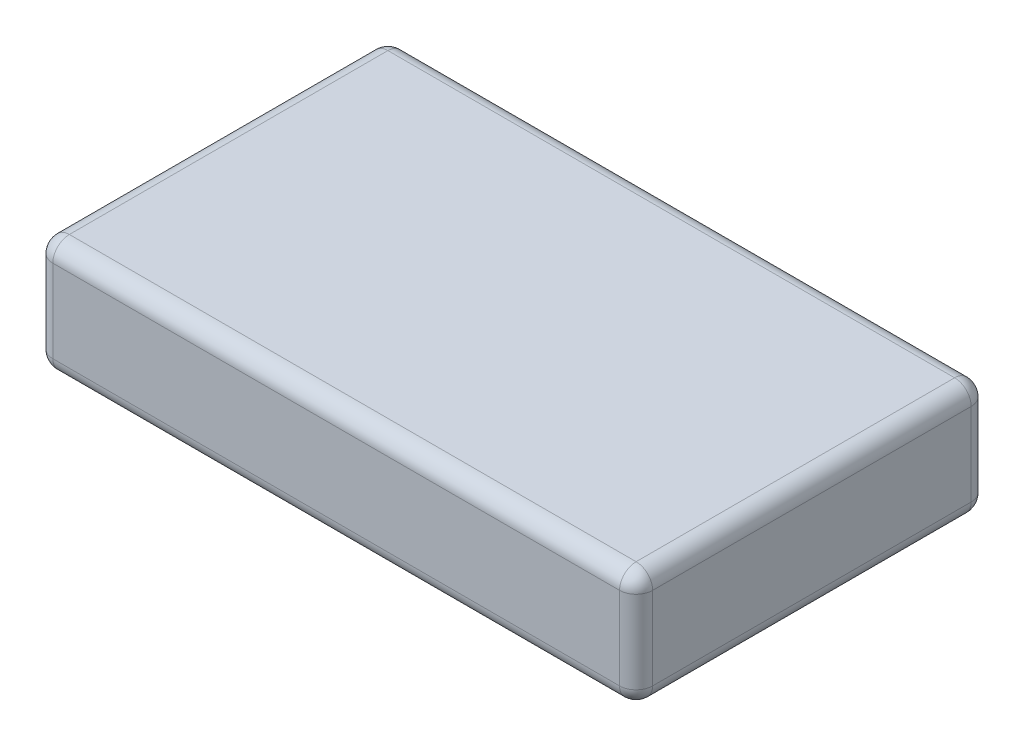
from build123d import *

# Parameters (mm, degrees)
IZIM1_W                     = 145
IZIM1_H                     = 85
Y_KSEKLIK_EKSTR_ZYON1_DEPTH = 28
IZIM2_R                     = 2.75
IZIM2_R_2                   = 0.5
KES_EKSTR_ZYON1_DEPTH       = 9
IZIM3_W                     = 4.5
IZIM3_H                     = 12
IZIM3_W_2                   = 2
IZIM3_H_2                   = 9.835751208
IZIM3_W_3                   = 0.86567422
IZIM3_H_3                   = 7
KES_EKSTR_ZYON2_DEPTH       = 9
RADYUS3_R                   = 4
RADYUS6_R                   = 4
RADYUS7_R                   = 4


with BuildPart() as part:
    # Çizim1 → Yükseklik-Ekstrüzyon1 (new body)
    with BuildSketch(Plane(origin=(0, 0, 0), x_dir=(1, 0, 0), z_dir=(0, 1, 0))):
        Rectangle(IZIM1_W, IZIM1_H)
    extrude(amount=Y_KSEKLIK_EKSTR_ZYON1_DEPTH)

    # Çizim2 → Kes-Ekstrüzyon1 (cut)
    with BuildSketch(Plane.ZY.offset(72.5)):
        with Locations((25.2, 12.4)):
            Circle(IZIM2_R)
        with Locations((25.2, 12.4)):
            Circle(IZIM2_R_2, mode=Mode.SUBTRACT)
    extrude(amount=-KES_EKSTR_ZYON1_DEPTH, mode=Mode.SUBTRACT)

    # Çizim3 → Kes-Ekstrüzyon2 (cut)
    with BuildSketch(Plane.ZY.offset(72.5)):
        with Locations((-26.625, 12.91875)):
            Rectangle(IZIM3_W, IZIM3_H)
        with Locations((-25.780796649, 12.91875)):
            Rectangle(IZIM3_W_2, IZIM3_H_2, mode=Mode.SUBTRACT)
        with Locations((-27.613610368, 12.91875)):
            Rectangle(IZIM3_W_3, IZIM3_H_3, mode=Mode.SUBTRACT)
    extrude(amount=-KES_EKSTR_ZYON2_DEPTH, mode=Mode.SUBTRACT)

    # Radyus3
    radyus3_edges = [part.edges().sort_by_distance(p)[0] for p in [
        (-72.5, 28, 0),
        (0, 28, 42.5),
        (72.5, 28, 0),
        (0, 28, -42.5),
    ]]
    fillet(radyus3_edges, radius=RADYUS3_R)

    # Radyus6
    radyus6_edges = [part.edges().sort_by_distance(p)[0] for p in [
        (0, 0, 42.5),
        (-72.5, 0, 0),
        (0, 0, -42.5),
        (72.5, 0, 0),
    ]]
    fillet(radyus6_edges, radius=RADYUS6_R)

    # Radyus7
    # the kernel refuses this fillet: 4 mm, written as the material it takes off along each edge
    with BuildSketch(Plane(origin=(-68.5, 24, 38.5), x_dir=(-1, 0, 0), z_dir=(0, 0, 1))) as radyus7_piece_1_section:
        Polygon((0, 0), (RADYUS7_R, 0), (RADYUS7_R, -RADYUS7_R), (0, -RADYUS7_R), align=None)
    radyus7_piece_1 = extrude(amount=RADYUS7_R, mode=Mode.PRIVATE)
    radyus7_piece_1 = radyus7_piece_1 - Plane(origin=(-68.5, 24, 38.5), x_dir=(0.7071067811865475, -0.7071067811865475, 0), z_dir=(0, 0, 1)) * Sphere(RADYUS7_R, mode=Mode.PRIVATE)
    add(radyus7_piece_1, mode=Mode.SUBTRACT)
    with BuildSketch(Plane(origin=(-68.5, 24, -38.5), x_dir=(0, 0, -1), z_dir=(-1, 0, 0))) as radyus7_piece_2_section:
        Polygon((0, 0), (RADYUS7_R, 0), (RADYUS7_R, -RADYUS7_R), (0, -RADYUS7_R), align=None)
    radyus7_piece_2 = extrude(amount=RADYUS7_R, mode=Mode.PRIVATE)
    radyus7_piece_2 = radyus7_piece_2 - Plane(origin=(-68.5, 24, -38.5), x_dir=(0, -0.7071067811865475, 0.7071067811865475), z_dir=(-1, 0, 0)) * Sphere(RADYUS7_R, mode=Mode.PRIVATE)
    add(radyus7_piece_2, mode=Mode.SUBTRACT)
    with BuildSketch(Plane(origin=(68.5, 24, 38.5), x_dir=(1, 0, 0), z_dir=(0, 0, 1))) as radyus7_piece_3_section:
        Polygon((0, 0), (RADYUS7_R, 0), (RADYUS7_R, RADYUS7_R), (0, RADYUS7_R), align=None)
    radyus7_piece_3 = extrude(amount=RADYUS7_R, mode=Mode.PRIVATE)
    radyus7_piece_3 = radyus7_piece_3 - Plane(origin=(68.5, 24, 38.5), x_dir=(-0.7071067811865475, -0.7071067811865475, 0), z_dir=(0, 0, 1)) * Sphere(RADYUS7_R, mode=Mode.PRIVATE)
    add(radyus7_piece_3, mode=Mode.SUBTRACT)
    with BuildSketch(Plane(origin=(68.5, 24, -38.5), x_dir=(0, 0, -1), z_dir=(1, 0, 0))) as radyus7_piece_4_section:
        Polygon((0, 0), (RADYUS7_R, 0), (RADYUS7_R, RADYUS7_R), (0, RADYUS7_R), align=None)
    radyus7_piece_4 = extrude(amount=RADYUS7_R, mode=Mode.PRIVATE)
    radyus7_piece_4 = radyus7_piece_4 - Plane(origin=(68.5, 24, -38.5), x_dir=(0, -0.7071067811865475, 0.7071067811865475), z_dir=(1, 0, 0)) * Sphere(RADYUS7_R, mode=Mode.PRIVATE)
    add(radyus7_piece_4, mode=Mode.SUBTRACT)
    with BuildSketch(Plane(origin=(68.5, 4, 38.5), x_dir=(1, 0, 0), z_dir=(0, 0, 1))) as radyus7_piece_5_section:
        Polygon((0, 0), (RADYUS7_R, 0), (RADYUS7_R, -RADYUS7_R), (0, -RADYUS7_R), align=None)
    radyus7_piece_5 = extrude(amount=RADYUS7_R, mode=Mode.PRIVATE)
    radyus7_piece_5 = radyus7_piece_5 - Plane(origin=(68.5, 4, 38.5), x_dir=(-0.7071067811865475, 0.7071067811865475, 0), z_dir=(0, 0, 1)) * Sphere(RADYUS7_R, mode=Mode.PRIVATE)
    add(radyus7_piece_5, mode=Mode.SUBTRACT)
    with BuildSketch(Plane(origin=(-68.5, 4, 38.5), x_dir=(-1, 0, 0), z_dir=(0, 0, 1))) as radyus7_piece_6_section:
        Polygon((0, 0), (RADYUS7_R, 0), (RADYUS7_R, RADYUS7_R), (0, RADYUS7_R), align=None)
    radyus7_piece_6 = extrude(amount=RADYUS7_R, mode=Mode.PRIVATE)
    radyus7_piece_6 = radyus7_piece_6 - Plane(origin=(-68.5, 4, 38.5), x_dir=(0.7071067811865475, 0.7071067811865475, 0), z_dir=(0, 0, 1)) * Sphere(RADYUS7_R, mode=Mode.PRIVATE)
    add(radyus7_piece_6, mode=Mode.SUBTRACT)
    with BuildSketch(Plane(origin=(68.5, 4, -38.5), x_dir=(0, 0, -1), z_dir=(1, 0, 0))) as radyus7_piece_7_section:
        Polygon((0, 0), (RADYUS7_R, 0), (RADYUS7_R, -RADYUS7_R), (0, -RADYUS7_R), align=None)
    radyus7_piece_7 = extrude(amount=RADYUS7_R, mode=Mode.PRIVATE)
    radyus7_piece_7 = radyus7_piece_7 - Plane(origin=(68.5, 4, -38.5), x_dir=(0, 0.7071067811865475, 0.7071067811865475), z_dir=(1, 0, 0)) * Sphere(RADYUS7_R, mode=Mode.PRIVATE)
    add(radyus7_piece_7, mode=Mode.SUBTRACT)
    with BuildSketch(Plane(origin=(-68.5, 4, -38.5), x_dir=(0, 0, -1), z_dir=(-1, 0, 0))) as radyus7_piece_8_section:
        Polygon((0, 0), (RADYUS7_R, 0), (RADYUS7_R, RADYUS7_R), (0, RADYUS7_R), align=None)
    radyus7_piece_8 = extrude(amount=RADYUS7_R, mode=Mode.PRIVATE)
    radyus7_piece_8 = radyus7_piece_8 - Plane(origin=(-68.5, 4, -38.5), x_dir=(0, 0.7071067811865475, 0.7071067811865475), z_dir=(-1, 0, 0)) * Sphere(RADYUS7_R, mode=Mode.PRIVATE)
    add(radyus7_piece_8, mode=Mode.SUBTRACT)
    with BuildSketch(Plane(origin=(72.5, 4, -42.5), x_dir=(0, 0, 1), z_dir=(0, 1, 0)), Plane(origin=(72.5, 4, 42.5), x_dir=(-1, 0, 0), z_dir=(0, 1, 0))) as radyus7_piece_9:
        with BuildLine():
            CenterArc((RADYUS7_R, -RADYUS7_R), RADYUS7_R, 90, 90)
            Line((0, -RADYUS7_R), (0, 0))
            Line((0, 0), (RADYUS7_R, 0))
        make_face()
    extrude(amount=20, mode=Mode.SUBTRACT)
    with BuildSketch(Plane(origin=(-72.5, 4, -42.5), x_dir=(0, 0, 1), z_dir=(0, 1, 0)), Plane(origin=(-72.5, 4, 42.5), x_dir=(1, 0, 0), z_dir=(0, 1, 0))) as radyus7_piece_10:
        with BuildLine():
            CenterArc((RADYUS7_R, RADYUS7_R), RADYUS7_R, 180, 90)
            Line((0, RADYUS7_R), (0, 0))
            Line((0, 0), (RADYUS7_R, 0))
        make_face()
    extrude(amount=20, mode=Mode.SUBTRACT)


solid = part.part
